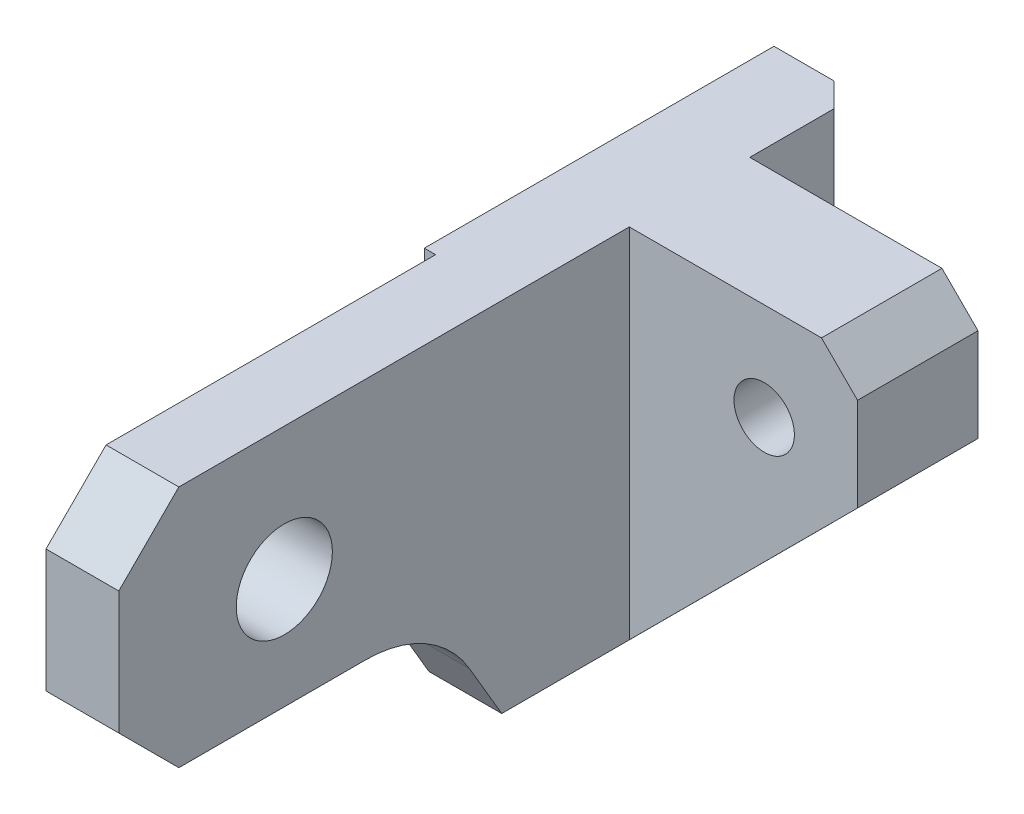
from build123d import *

# Parameters (mm, degrees)
EXTRUDE_1_DEPTH     = 7
FILLET_1_R          = 10
CHAMFER_1_SIZE      = 5
SKETCH_3_W          = 3.25461804
SKETCH_3_H          = 54.107720412
CUT_EXTRUDE_2_DEPTH = 47.067962478
SKETCH_4_R          = 4
CUT_EXTRUDE_3_DEPTH = 47.067962478
SKETCH_5_W          = 10.028686974
SKETCH_5_H          = 29.771176491
EXTRUDE_2_DEPTH     = 19
CHAMFER_3_SIZE      = 19
CHAMFER_4_SIZE      = 3
SKETCH_6_R          = 2.514235327
CUT_EXTRUDE_4_DEPTH = 64.298215394
CHAMFER_5_SIZE      = 2


with BuildPart() as part:
    # Эскиз1 → Вытянуть1 (new body)
    with BuildSketch(Plane(origin=(0, 0, 0), x_dir=(0, 0, -1), z_dir=(1, 0, 0))):
        Polygon((-2.568460462, -29.775860751), (-8.159933039, -20.242473248), (-34.447863263, -20.242473248), (-34.447863263, 0), (27.095667874, 0), (27.095667874, -29.775860751), align=None)
    extrude(amount=-EXTRUDE_1_DEPTH)

    # Скругление1
    fillet_1_edges = [part.edges().sort_by_distance(p)[0] for p in [
        (-3.5, -20.242473248, 8.159933039),
    ]]
    fillet(fillet_1_edges, radius=FILLET_1_R)

    # Фаска1
    chamfer_1_edges = [part.edges().sort_by_distance(p)[0] for p in [
        (-3.5, -20.242473248, 34.447863263),
        (-3.5, 0, 34.447863263),
    ]]
    chamfer(chamfer_1_edges, length=CHAMFER_1_SIZE)

    # Эскиз3 → Вырез-Вытянуть2 (cut, through all)
    with BuildSketch(Plane(origin=(0, 0, 0), x_dir=(1, 0, 0), z_dir=(0, 1, 0))):
        with Locations((-7.6877425, -29.069741347)):
            Rectangle(SKETCH_3_W, SKETCH_3_H)
    extrude(amount=-CUT_EXTRUDE_2_DEPTH, mode=Mode.SUBTRACT)

    # Эскиз4 → Вырез-Вытянуть3 (cut, through all)
    with BuildSketch(Plane(origin=(0, 0, 0), x_dir=(0, 0, -1), z_dir=(1, 0, 0))):
        with Locations((-20.668500614, -11.046677749)):
            Circle(SKETCH_4_R)
    extrude(amount=-CUT_EXTRUDE_3_DEPTH, mode=Mode.SUBTRACT)

    # Эскиз5 → Вытянуть2 (add)
    with BuildSketch(Plane(origin=(0, 0, 0), x_dir=(0, 0, -1), z_dir=(1, 0, 0))):
        with Locations((13.06456917, -14.885588246)):
            Rectangle(SKETCH_5_W, SKETCH_5_H)
    extrude(amount=EXTRUDE_2_DEPTH)

    # Фаска3
    chamfer_3_edges = [part.edges().sort_by_distance(p)[0] for p in [
        (19, -29.771176491, -13.06456917),
    ]]
    chamfer(chamfer_3_edges, length=CHAMFER_3_SIZE - 0.0001)  # a hair under: the kernel refuses the full size

    # Фаска4
    chamfer_4_edges = [part.edges().sort_by_distance(p)[0] for p in [
        (19, 0, -13.06456917),
    ]]
    chamfer(chamfer_4_edges, length=CHAMFER_4_SIZE)

    # Эскиз6 → Вырез-Вытянуть4 (cut, through all)
    with BuildSketch(Plane(origin=(0, 0, -18.078912657), x_dir=(-1, 0, 0), z_dir=(0, 0, -1))):
        with Locations((-11.229341263, -8.118042122)):
            Circle(SKETCH_6_R)
    extrude(amount=-CUT_EXTRUDE_4_DEPTH, mode=Mode.SUBTRACT)

    # Фаска5
    chamfer_5_edges = [part.edges().sort_by_distance(p)[0] for p in [
        (0, -14.887930375, -27.095667874),
    ]]
    chamfer(chamfer_5_edges, length=CHAMFER_5_SIZE)


solid = part.part
